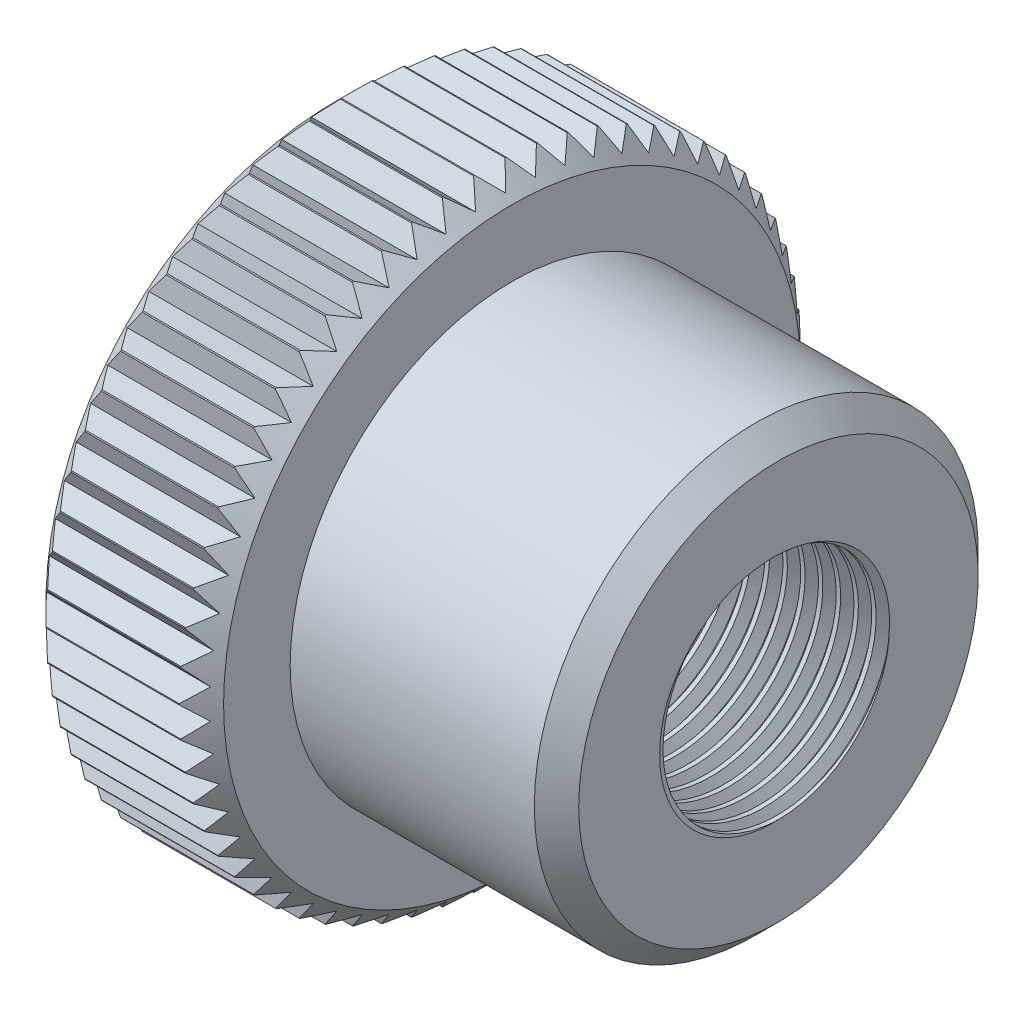
from build123d import *

# Parameters (mm, degrees)
CHAMFER1_SIZE      = 0.5
THREAD1_PITCH      = 0.4
CUT_EXTRUDE1_DEPTH = 10
CIRPATTERN1_COUNT  = 62


with BuildPart() as part:
    # Sketch1 → Revolve1 (revolve)
    with BuildSketch(Plane.XY, mode=Mode.PRIVATE) as revolve1_sk:
        Polygon((10, 2.5), (0, 2.5), (0, 7), (4, 7), (4, 5), (10, 5), align=None)
    revolve(revolve1_sk.sketch.rotate(Axis((0, 0, 0), (1, 0, 0)), 90), axis=Axis((0, 0, 0), (1, 0, 0)))

    # Chamfer1
    chamfer1_edges = [part.edges().sort_by_distance(p)[0] for p in [
        (10, 0, -5),
        (4, 0, -7),
        (0, 0, -7),
        (0, 0, -2.5),
    ]]
    chamfer(chamfer1_edges, length=CHAMFER1_SIZE)

    # Thread1: arcs per turn and ends read off the stored shape
    # Thread1: the profile of Sketch3 profile screwed along a right-hand helix through 27.5 turns, 6 arcs to a turn; built about Z, then put on its axis
    thread1_z = Axis((0, 0, 0), (0, 0, 1))
    thread1_corners = [(2.4997, 0, -0.000173205), (2.71650635, 0, 0.124999999), (2.71650635, 0, 0.174999999), (2.4997, 0, 0.300173204)]
    with BuildLine(mode=Mode.PRIVATE) as thread1_profile:
        Line(thread1_corners[0], thread1_corners[1])
        Line(thread1_corners[1], thread1_corners[2])
        Line(thread1_corners[2], thread1_corners[3])
        Line(thread1_corners[3], thread1_corners[0])
    thread1_cap = Face(thread1_profile.wire())
    thread1_turn_angles = [0, 30, 60, 90, 120, 150, 180, 210, 240, 270, 300, 330, 360]
    thread1_turn_weights = [1, 0.8660254037844387, 1, 0.8660254037844387, 1, 0.8660254037844387, 1, 0.8660254037844387, 1, 0.8660254037844387, 1, 0.8660254037844387, 1]
    thread1_turn_rails = [Edge.make_bspline([Vector(p[0], p[1], 0).rotate(thread1_z, thread1_turn_angles[k]) / thread1_turn_weights[k] + Vector(0, 0, p[2] + THREAD1_PITCH * thread1_turn_angles[k] / 360) for k in range(13)], [0, 0, 0, 1, 1, 2, 2, 3, 3, 4, 4, 5, 5, 6, 6, 6], 2, thread1_turn_weights) for p in thread1_corners]
    thread1_turn_sides = [Face.make_surface_from_curves(thread1_turn_rails[p[0]], thread1_turn_rails[p[1]]) for p in [(0, 1), (1, 2), (2, 3), (3, 0)]]
    thread1_last_angles = [9720, 9750, 9780, 9810, 9840, 9870, 9900]
    thread1_last_weights = [1, 0.8660254037844387, 1, 0.8660254037844387, 1, 0.8660254037844387, 1]
    thread1_last_rails = [Edge.make_bspline([Vector(p[0], p[1], 0).rotate(thread1_z, thread1_last_angles[k]) / thread1_last_weights[k] + Vector(0, 0, p[2] + THREAD1_PITCH * thread1_last_angles[k] / 360) for k in range(7)], [0, 0, 0, 1, 1, 2, 2, 3, 3, 3], 2, thread1_last_weights) for p in thread1_corners]
    thread1_last_sides = [Face.make_surface_from_curves(thread1_last_rails[p[0]], thread1_last_rails[p[1]]) for p in [(0, 1), (1, 2), (2, 3), (3, 0)]]
    thread1 = Plane(origin=(11, 0, 0), x_dir=(0, 0, 1), z_dir=(-1, 0, 0)) * Solid(Shell([*[p.moved(Location((0, 0, THREAD1_PITCH * i))) for i in range(27) for p in thread1_turn_sides], *thread1_last_sides, thread1_cap, thread1_cap.rotate(thread1_z, 9900).moved(Location((0, 0, THREAD1_PITCH * 9900 / 360)))]))
    add(thread1, mode=Mode.SUBTRACT)

    # Sketch6 → Cut-Extrude1 (cut)
    with BuildSketch(Plane.ZY):
        Polygon((-2, 8.65), (0, 6.65), (2, 8.65), align=None)
    cut_extrude1 = extrude(amount=-CUT_EXTRUDE1_DEPTH, mode=Mode.SUBTRACT)

    # CirPattern1: Cut-Extrude1 ×62 about axis
    cirpattern1_axis = Axis((0, 0, 0), (1, 0, 0))
    for i in range(1, CIRPATTERN1_COUNT):
        add(cut_extrude1.rotate(cirpattern1_axis, i * 360 / CIRPATTERN1_COUNT), mode=Mode.SUBTRACT)


solid = part.part
